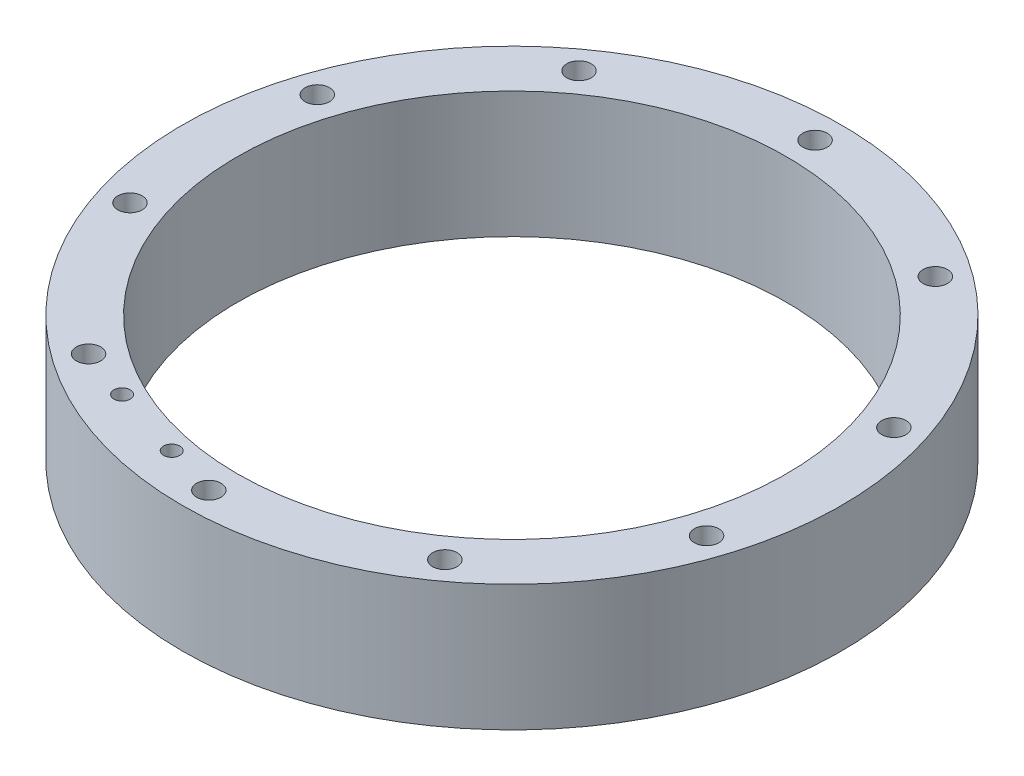
from build123d import *

# Parameters (mm, degrees)
SKETCH1_R           = 40.5
SKETCH1_R_2         = 1.5
SKETCH1_R_3         = 33.75
BOSS_EXTRUDE1_DEPTH = 15.5
SKETCH2_R           = 1
CUT_EXTRUDE1_DEPTH  = 60.335908184


with BuildPart() as part:
    # Sketch1 → Boss-Extrude1 (new body)
    with BuildSketch(Plane(origin=(0, 0, 0), x_dir=(1, 0, 0), z_dir=(0, 1, 0))):
        Circle(SKETCH1_R)
        with Locations((0, 37.25)):
            Circle(SKETCH1_R_2, mode=Mode.SUBTRACT)
        with Locations((21.895000648, 30.13588304)):
            Circle(SKETCH1_R_2, mode=Mode.SUBTRACT)
        with Locations((35.426855232, 11.51088304)):
            Circle(SKETCH1_R_2, mode=Mode.SUBTRACT)
        with Locations((35.426855232, -11.51088304)):
            Circle(SKETCH1_R_2, mode=Mode.SUBTRACT)
        with Locations((21.895000648, -30.13588304)):
            Circle(SKETCH1_R_2, mode=Mode.SUBTRACT)
        with Locations((0, -37.25)):
            Circle(SKETCH1_R_2, mode=Mode.SUBTRACT)
        with Locations((-21.895000648, -30.13588304)):
            Circle(SKETCH1_R_2, mode=Mode.SUBTRACT)
        with Locations((-35.426855232, -11.51088304)):
            Circle(SKETCH1_R_2, mode=Mode.SUBTRACT)
        with Locations((-35.426855232, 11.51088304)):
            Circle(SKETCH1_R_2, mode=Mode.SUBTRACT)
        with Locations((-21.895000648, 30.13588304)):
            Circle(SKETCH1_R_2, mode=Mode.SUBTRACT)
        Circle(SKETCH1_R_3, mode=Mode.SUBTRACT)
    extrude(amount=BOSS_EXTRUDE1_DEPTH)

    # Sketch2 → Cut-Extrude1 (cut, through all)
    with BuildSketch(Plane(origin=(0, 15.5, 0), x_dir=(1, 0, 0), z_dir=(0, 1, 0))):
        with Locations((-6.483486619, -35.325442924)):
            Circle(SKETCH2_R)
        with Locations((-15.518523524, -32.389781477)):
            Circle(SKETCH2_R)
    extrude(amount=-CUT_EXTRUDE1_DEPTH, mode=Mode.SUBTRACT)


solid = part.part
